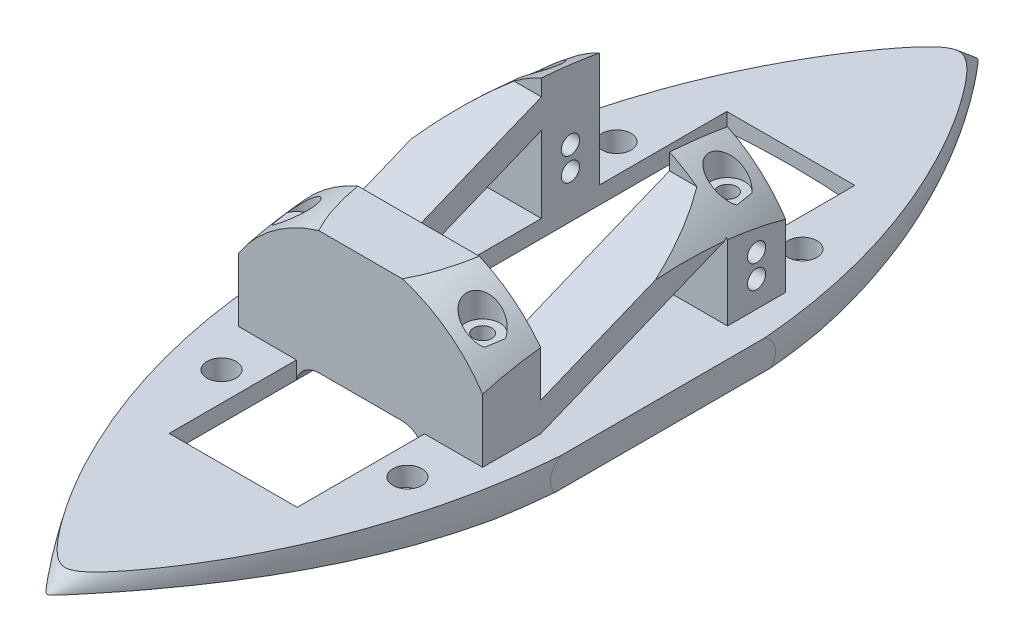
from build123d import *

# Parameters (mm, degrees)
SKETCH2_W                      = 33.02
SKETCH2_H                      = 3.175
BOSS_EXTRUDE1_DEPTH            = 101.6
SKETCH3_R                      = 78.359
CUT_EXTRUDE1_DEPTH             = 103.944937983
SKETCH5_W                      = 6.35
SKETCH5_H                      = 6.35
BOSS_EXTRUDE2_DEPTH            = 15.24
SKETCH13_W                     = 6.35
SKETCH13_H                     = 13.462
BOSS_EXTRUDE5_DEPTH            = 13.9954
BOSS_EXTRUDE3_DEPTH            = 6.35
CUT_REVOLVE1_ANGLE             = 100
CUT_REVOLVE1_OTHER_WAY_ANGLE   = 100
CUT_EXTRUDE2_REACH             = 105.809
CUT_EXTRUDE2_END_RADIUS        = 78.359
SKETCH7_W                      = 13.9954
SKETCH7_H                      = 60.96
CUT_EXTRUDE3_REACH             = 108.96
SKETCH8_R                      = 1
CUT_EXTRUDE3_DIRECTION_2_DEPTH = 107.96041197
CUT_EXTRUDE4_REACH             = 105.809
CUT_EXTRUDE4_END_RADIUS        = 78.359
SKETCH9_R                      = 1.5875
CUT_EXTRUDE5_REACH             = 115.334
CUT_EXTRUDE5_START             = 9.525
SKETCH11_R                     = 1.905
SKETCH12_R                     = 1
CUT_EXTRUDE6_DEPTH             = 4.445
FILLET1_R                      = 2.54


with BuildPart() as part:
    # Sketch2 → Boss-Extrude1 (new body)
    with BuildSketch(Plane.XY):
        Rectangle(SKETCH2_W, SKETCH2_H)
    extrude(amount=BOSS_EXTRUDE1_DEPTH)

    # Sketch3 → Cut-Extrude1 (cut, through all)
    with BuildSketch(Plane.XY.offset(101.6)):
        with Locations((0, -78.359)):
            Circle(SKETCH3_R)
    extrude(amount=-CUT_EXTRUDE1_DEPTH, mode=Mode.SUBTRACT)

    # Sketch5 → Boss-Extrude2 (add)
    with BuildSketch(Plane(origin=(0, 1.5875, 0), x_dir=(1, 0, 0), z_dir=(0, 1, 0))):
        with Locations((-10.1727, -37.4142)):
            Rectangle(SKETCH5_W, SKETCH5_H)
        with Locations((10.1727, -37.4142)):
            Rectangle(SKETCH5_W, SKETCH5_H)
        with Locations((-10.1727, -64.1858)):
            Rectangle(SKETCH5_W, SKETCH5_H)
        with Locations((10.1727, -64.1858)):
            Rectangle(SKETCH5_W, SKETCH5_H)
    extrude(amount=BOSS_EXTRUDE2_DEPTH)

    # Sketch13 → Boss-Extrude5 (add)
    with BuildSketch(Plane.ZY.offset(-6.9977)):
        with Locations((64.1858, 8.3185)):
            Rectangle(SKETCH13_W, SKETCH13_H)
    extrude(amount=BOSS_EXTRUDE5_DEPTH)

    # Sketch6 → Boss-Extrude3 (add)
    with BuildSketch(Plane(origin=(13.3477, 0, 0), x_dir=(0, 0, -1), z_dir=(1, 0, 0))):
        Polygon((-61.0108, 1.5875), (-61.0108, 4.7625), (-40.5892, 13.097993592), (-40.5892, 9.922993592), align=None)
    boss_extrude3 = extrude(amount=-BOSS_EXTRUDE3_DEPTH)

    # Mirror4: Boss-Extrude3 across plane
    add(boss_extrude3.mirror(Plane(origin=(0, 0, 0), x_dir=(0, 0, 1), z_dir=(1, 0, 0))))

    # Sketch4 → Cut-Revolve1 (revolve, cut)
    with BuildSketch(Plane(origin=(0, 0, 0), x_dir=(0, 0, -1), z_dir=(1, 0, 0))):
        with BuildLine():
            Line((-48.26, 16.51), (-53.34, 16.51))
            ThreePointArc((-53.34, 16.51), (-79.030872285, 12.817549757), (-101.6, 0))
            Line((-101.6, 0), (-101.6, 25.4))
            Line((-101.6, 25.4), (0, 25.4))
            Line((0, 25.4), (0, 0))
            ThreePointArc((0, 0), (-22.569127715, 12.817549757), (-48.26, 16.51))
        make_face()
    revolve(axis=Axis((0, -0.254, 0), (0, 0, 1)), revolution_arc=CUT_REVOLVE1_ANGLE, mode=Mode.SUBTRACT)

    # Sketch4 → Cut-Revolve1 other way (revolve, cut)
    with BuildSketch(Plane(origin=(0, 0, 0), x_dir=(0, 0, -1), z_dir=(1, 0, 0))):
        with BuildLine():
            Line((-48.26, 16.51), (-53.34, 16.51))
            ThreePointArc((-53.34, 16.51), (-79.030872285, 12.817549757), (-101.6, 0))
            Line((-101.6, 0), (-101.6, 25.4))
            Line((-101.6, 25.4), (0, 25.4))
            Line((0, 25.4), (0, 0))
            ThreePointArc((0, 0), (-22.569127715, 12.817549757), (-48.26, 16.51))
        make_face()
    revolve(axis=Axis((0, -0.254, 0), (0, 0, -1)), revolution_arc=CUT_REVOLVE1_OTHER_WAY_ANGLE, mode=Mode.SUBTRACT)

    # Cut-Extrude2: up to this cylinder (the profile starts outside it)
    cut_extrude2_end = Plane(origin=(0, -78.359, 50.8), z_dir=(0, 0, 1)) * Cylinder(CUT_EXTRUDE2_END_RADIUS, 369.336, mode=Mode.PRIVATE)
    # Sketch7 → Cut-Extrude2 (cut, up to the surface)
    with BuildSketch(Plane(origin=(0, 1.5875, 0), x_dir=(1, 0, 0), z_dir=(0, 1, 0)), mode=Mode.PRIVATE) as cut_extrude2_sk1:
        with Locations((0, -50.8)):
            Rectangle(SKETCH7_W, SKETCH7_H)
    cut_extrude2_tool1 = extrude(cut_extrude2_sk1.sketch, amount=-CUT_EXTRUDE2_REACH, mode=Mode.PRIVATE) - cut_extrude2_end
    add(cut_extrude2_tool1.solids().sort_by_distance((0, 1.5875, 50.8))[0], mode=Mode.SUBTRACT)

    # Cut-Extrude3: up to this face of the body (flat: up to its plane)
    cut_extrude3_end = Plane(part.part.faces().sort_by_distance((-13.3477, 5.415399425, 37.499469611))[0])
    # Sketch8 → Cut-Extrude3 (cut, up to the picked face)
    with BuildSketch(Plane(origin=(13.3477, 0, 0), x_dir=(0, 0, -1), z_dir=(1, 0, 0)), mode=Mode.PRIVATE) as cut_extrude3_sk1:
        with Locations((-37.4142, 6.985)):
            Circle(SKETCH8_R)
    cut_extrude3_tool1 = split(extrude(cut_extrude3_sk1.sketch, amount=-CUT_EXTRUDE3_REACH, mode=Mode.PRIVATE), bisect_by=cut_extrude3_end, keep=Keep.BOTH, mode=Mode.PRIVATE)
    # Sketch8 → Cut-Extrude3 (cut, up to the picked face)
    with BuildSketch(Plane(origin=(13.3477, 0, 0), x_dir=(0, 0, -1), z_dir=(1, 0, 0)), mode=Mode.PRIVATE) as cut_extrude3_sk2:
        with Locations((-37.4142, 4.445)):
            Circle(SKETCH8_R)
    cut_extrude3_tool2 = split(extrude(cut_extrude3_sk2.sketch, amount=-CUT_EXTRUDE3_REACH, mode=Mode.PRIVATE), bisect_by=cut_extrude3_end, keep=Keep.BOTH, mode=Mode.PRIVATE)
    add(cut_extrude3_tool1.solids().sort_by(Axis((13.3477, 6.985, 37.4142), (-1, 0, 0)))[0], mode=Mode.SUBTRACT)
    add(cut_extrude3_tool2.solids().sort_by(Axis((13.3477, 4.445, 37.4142), (-1, 0, 0)))[0], mode=Mode.SUBTRACT)

    # Sketch8 → Cut-Extrude3 direction 2 (cut)
    with BuildSketch(Plane(origin=(13.3477, 0, 0), x_dir=(0, 0, -1), z_dir=(1, 0, 0))):
        with Locations((-37.4142, 6.985)):
            Circle(SKETCH8_R)
        with Locations((-37.4142, 4.445)):
            Circle(SKETCH8_R)
    extrude(amount=CUT_EXTRUDE3_DIRECTION_2_DEPTH, mode=Mode.SUBTRACT)

    # Cut-Extrude4: up to this cylinder (the profile starts outside it)
    cut_extrude4_end = Plane(origin=(0, -78.359, 50.8), z_dir=(0, 0, 1)) * Cylinder(CUT_EXTRUDE4_END_RADIUS, 412.516, mode=Mode.PRIVATE)
    # Sketch9 → Cut-Extrude4 (cut, up to the surface)
    with BuildSketch(Plane(origin=(0, 1.5875, 0), x_dir=(1, 0, 0), z_dir=(0, 1, 0)), mode=Mode.PRIVATE) as cut_extrude4_sk1:
        with Locations(Location((-10.16, -72.39, 0), (0, 0, 270))):
            Circle(SKETCH9_R)
    cut_extrude4_tool1 = extrude(cut_extrude4_sk1.sketch, amount=-CUT_EXTRUDE4_REACH, mode=Mode.PRIVATE) - cut_extrude4_end
    add(cut_extrude4_tool1.solids().sort_by_distance((-10.16, 1.5875, 72.39))[0], mode=Mode.SUBTRACT)
    # Sketch9 → Cut-Extrude4 (cut, up to the surface)
    with BuildSketch(Plane(origin=(0, 1.5875, 0), x_dir=(1, 0, 0), z_dir=(0, 1, 0)), mode=Mode.PRIVATE) as cut_extrude4_sk2:
        with Locations(Location((-10.16, -29.21, 0), (0, 0, 270))):
            Circle(SKETCH9_R)
    cut_extrude4_tool2 = extrude(cut_extrude4_sk2.sketch, amount=-CUT_EXTRUDE4_REACH, mode=Mode.PRIVATE) - cut_extrude4_end
    add(cut_extrude4_tool2.solids().sort_by_distance((-10.16, 1.5875, 29.21))[0], mode=Mode.SUBTRACT)
    # Sketch9 → Cut-Extrude4 (cut, up to the surface)
    with BuildSketch(Plane(origin=(0, 1.5875, 0), x_dir=(1, 0, 0), z_dir=(0, 1, 0)), mode=Mode.PRIVATE) as cut_extrude4_sk3:
        with Locations(Location((10.16, -72.39, 0), (0, 0, 270))):
            Circle(SKETCH9_R)
    cut_extrude4_tool3 = extrude(cut_extrude4_sk3.sketch, amount=-CUT_EXTRUDE4_REACH, mode=Mode.PRIVATE) - cut_extrude4_end
    add(cut_extrude4_tool3.solids().sort_by_distance((10.16, 1.5875, 72.39))[0], mode=Mode.SUBTRACT)
    # Sketch9 → Cut-Extrude4 (cut, up to the surface)
    with BuildSketch(Plane(origin=(0, 1.5875, 0), x_dir=(1, 0, 0), z_dir=(0, 1, 0)), mode=Mode.PRIVATE) as cut_extrude4_sk4:
        with Locations(Location((10.16, -29.21, 0), (0, 0, 270))):
            Circle(SKETCH9_R)
    cut_extrude4_tool4 = extrude(cut_extrude4_sk4.sketch, amount=-CUT_EXTRUDE4_REACH, mode=Mode.PRIVATE) - cut_extrude4_end
    add(cut_extrude4_tool4.solids().sort_by_distance((10.16, 1.5875, 29.21))[0], mode=Mode.SUBTRACT)

    # Sketch11 → Cut-Extrude5 (cut, up to next)
    with BuildSketch(Plane(origin=(0, 1.5875, 0), x_dir=(1, 0, 0), z_dir=(0, 1, 0)).offset(CUT_EXTRUDE5_START), mode=Mode.PRIVATE) as cut_extrude5_sk1:
        with Locations((-10.1727, -37.4142)):
            Circle(SKETCH11_R)
    cut_extrude5_tool1 = extrude(cut_extrude5_sk1.sketch, amount=CUT_EXTRUDE5_REACH, mode=Mode.PRIVATE) & part.part
    # Sketch11 → Cut-Extrude5 (cut, up to next)
    with BuildSketch(Plane(origin=(0, 1.5875, 0), x_dir=(1, 0, 0), z_dir=(0, 1, 0)).offset(CUT_EXTRUDE5_START), mode=Mode.PRIVATE) as cut_extrude5_sk2:
        with Locations((10.1727, -37.4142)):
            Circle(SKETCH11_R)
    cut_extrude5_tool2 = extrude(cut_extrude5_sk2.sketch, amount=CUT_EXTRUDE5_REACH, mode=Mode.PRIVATE) & part.part
    # Sketch11 → Cut-Extrude5 (cut, up to next)
    with BuildSketch(Plane(origin=(0, 1.5875, 0), x_dir=(1, 0, 0), z_dir=(0, 1, 0)).offset(CUT_EXTRUDE5_START), mode=Mode.PRIVATE) as cut_extrude5_sk3:
        with Locations((10.1727, -64.1858)):
            Circle(SKETCH11_R)
    cut_extrude5_tool3 = extrude(cut_extrude5_sk3.sketch, amount=CUT_EXTRUDE5_REACH, mode=Mode.PRIVATE) & part.part
    # Sketch11 → Cut-Extrude5 (cut, up to next)
    with BuildSketch(Plane(origin=(0, 1.5875, 0), x_dir=(1, 0, 0), z_dir=(0, 1, 0)).offset(CUT_EXTRUDE5_START), mode=Mode.PRIVATE) as cut_extrude5_sk4:
        with Locations((-10.1727, -64.1858)):
            Circle(SKETCH11_R)
    cut_extrude5_tool4 = extrude(cut_extrude5_sk4.sketch, amount=CUT_EXTRUDE5_REACH, mode=Mode.PRIVATE) & part.part
    add(cut_extrude5_tool1.solids().sort_by_distance((-10.1727, 11.1125, 37.4142))[0], mode=Mode.SUBTRACT)
    add(cut_extrude5_tool2.solids().sort_by_distance((10.1727, 11.1125, 37.4142))[0], mode=Mode.SUBTRACT)
    add(cut_extrude5_tool3.solids().sort_by_distance((10.1727, 11.1125, 64.1858))[0], mode=Mode.SUBTRACT)
    add(cut_extrude5_tool4.solids().sort_by_distance((-10.1727, 11.1125, 64.1858))[0], mode=Mode.SUBTRACT)

    # Sketch12 → Cut-Extrude6 (cut)
    with BuildSketch(Plane(origin=(0, 11.1125, 0), x_dir=(1, 0, 0), z_dir=(0, 1, 0))):
        with Locations(Location((10.1727, -64.1858, 0), (0, 0, 270))):
            Circle(SKETCH12_R)
        with Locations(Location((-10.1727, -64.1858, 0), (0, 0, 90))):
            Circle(SKETCH12_R)
        with Locations(Location((-10.1727, -37.4142, 0), (0, 0, 270))):
            Circle(SKETCH12_R)
        with Locations(Location((10.1727, -37.4142, 0), (0, 0, 90))):
            Circle(SKETCH12_R)
    extrude(amount=-CUT_EXTRUDE6_DEPTH, mode=Mode.SUBTRACT)

    # Fillet1
    # the kernel refuses this fillet: 2.54 mm, written as the material it adds along each edge
    with BuildSketch(Plane(origin=(-6.9977, 1.5875, 61.0108), x_dir=(1, 0, 0), z_dir=(0, 0, 1)), Plane(origin=(6.9977, 1.5875, 67.3608), x_dir=(-1, 0, 0), z_dir=(0, 0, -1))) as fillet1_piece_1:
        with BuildLine():
            CenterArc((2.458199869, -2.54), FILLET1_R, 90, 75.419572904)
            Line((0, -1.900583542), (0, 0))
            Line((0, 0), (2.458199869, 0))
        make_face()
    extrude(amount=6.35)


solid = part.part
